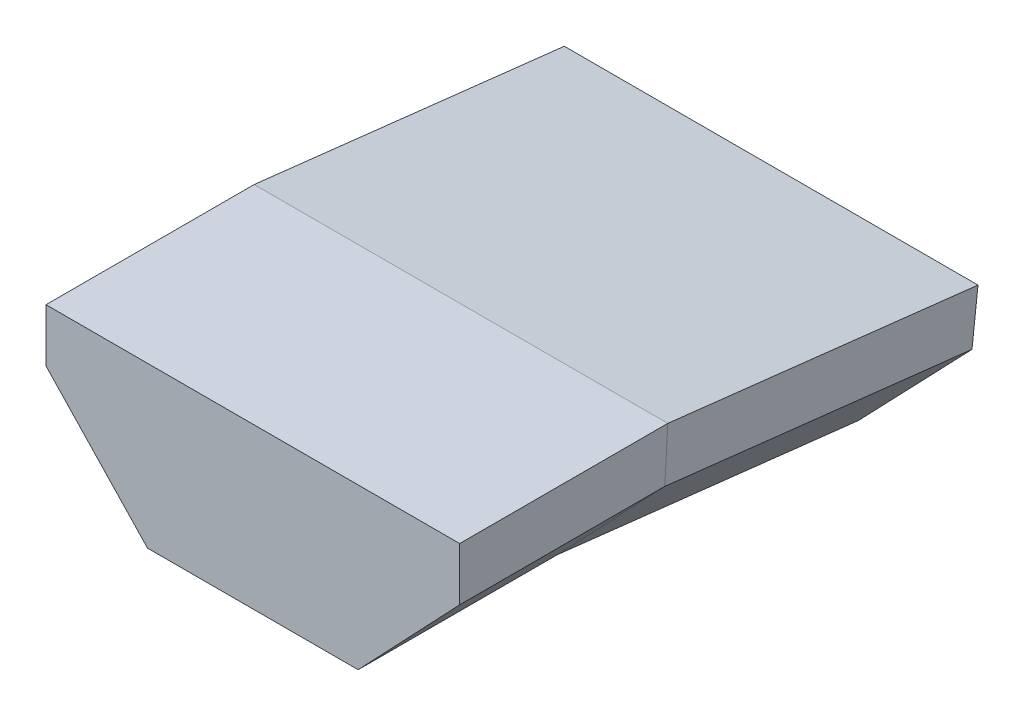
from build123d import *


with BuildPart() as part:
    # Sweep1: sweep along a path in Sketch2
    with BuildLine(Plane(origin=(0, 0, 0), x_dir=(0, 0, -1), z_dir=(1, 0, 0))) as sweep1_path:
        Line((0, 0), (8, 0))
        Line((8, 0), (19.922862268, -1.358438565))
    # Sketch1 → Sweep1 (sweep)
    with BuildSketch(Plane.XY):
        Polygon((7.95, 0), (7.95, -2.04), (4.048, -6.152414984), (-4.048, -6.152414984), (-7.95, -2.04), (-7.95, 0), align=None)
    sweep(path=sweep1_path.line, transition=Transition.RIGHT)


solid = part.part
